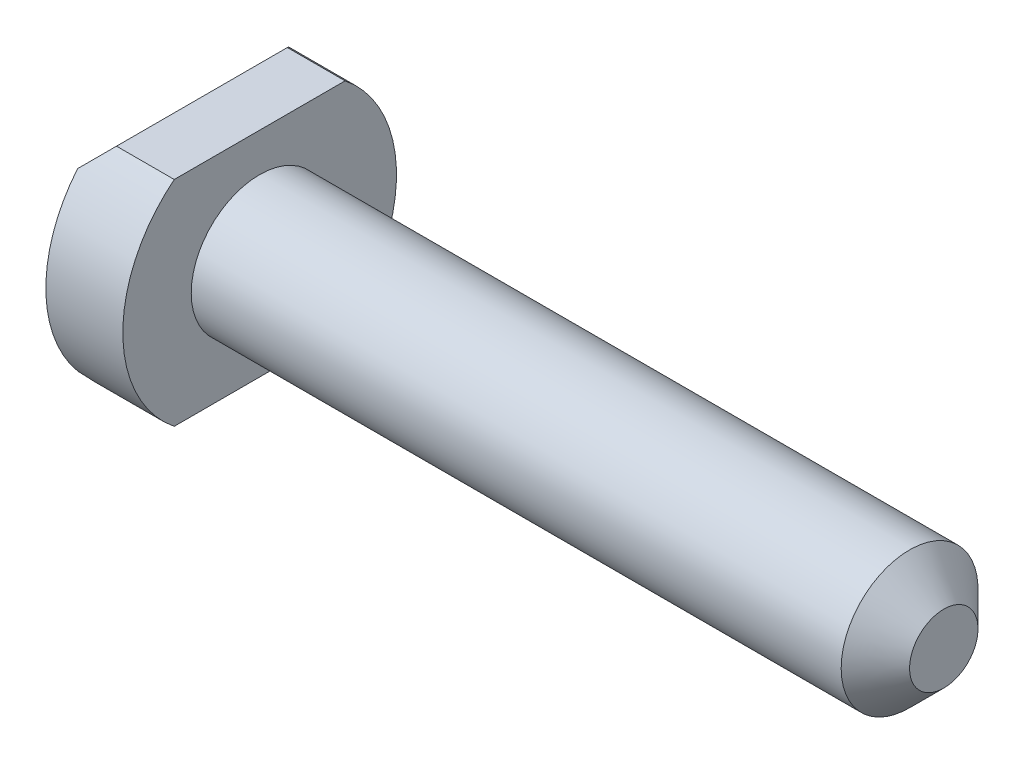
from build123d import *

# Parameters (mm, degrees)
BASEHEAD_DEPTH   = 9
HEADCHAMFER_SIZE = 2.25
BOLTSKE_W        = 20
BOLTSKE_H        = 8


with BuildPart() as part:
    # BaseHeadSke → BaseHead (new body)
    with BuildSketch(Plane(origin=(0, 0, 0), x_dir=(0, 0, -1), z_dir=(1, 0, 0))):
        with BuildLine():
            Line((-9.987492178, 12.5), (9.987492178, 12.5))
            ThreePointArc((9.987492178, 12.5), (16, 0), (9.987492178, -12.5))
            Line((9.987492178, -12.5), (-9.987492178, -12.5))
            ThreePointArc((-9.987492178, -12.5), (-16, 0), (-9.987492178, 12.5))
        make_face()
    extrude(amount=BASEHEAD_DEPTH)

    # HeadChamfer
    headchamfer_edges = [part.edges().sort_by_distance(p)[0] for p in [
        (0, -12.5, 0),
        (0, 12.5, 0),
    ]]
    chamfer(headchamfer_edges, length=HEADCHAMFER_SIZE)

    # BodySke → BaseBody (revolve)
    with BuildSketch(Plane.XY):
        Polygon((85, 8), (89, 4), (89, 0), (0, 0), (0, 8), align=None)
    revolve(axis=Axis((0, 0, 0), (1, 0, 0)))

    # BoltSke → Bolt (revolve)
    with BuildSketch(Plane.XY):
        with Locations((19, 4)):
            Rectangle(BOLTSKE_W, BOLTSKE_H)
    revolve(axis=Axis((0, 0, 0), (1, 0, 0)))


solid = part.part
